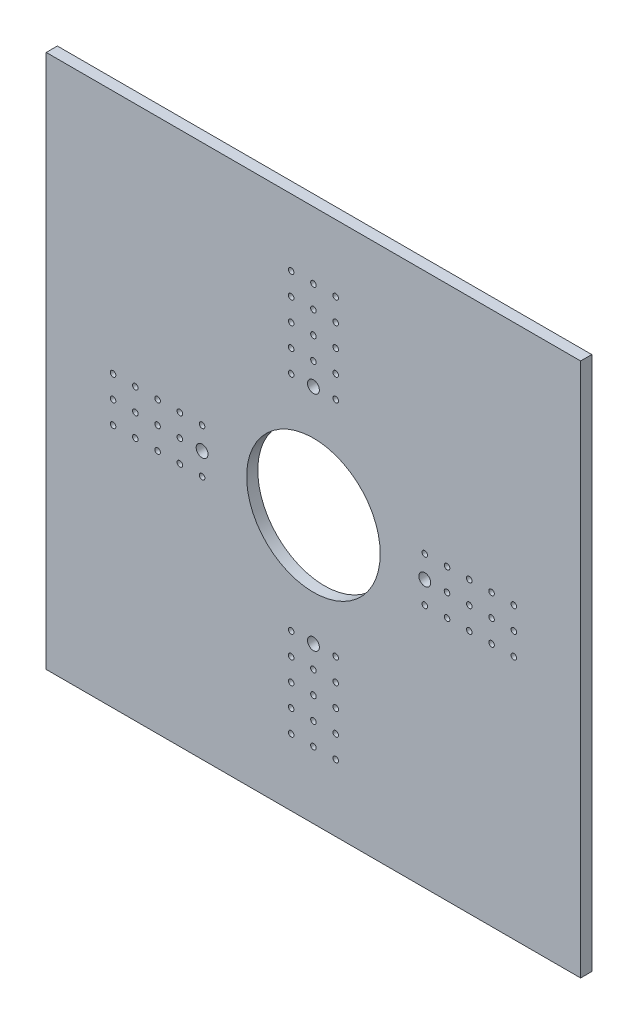
from build123d import *

# Parameters (mm, degrees)
SKETCH1_W                    = 609.6
SKETCH1_H                    = 609.6
SKETCH1_R                    = 76.2
BOSS_EXTRUDE1_DEPTH          = 12.7
CUT_EXTRUDE1_REACH           = 433.239
SKETCH3_R                    = 3.175
LPATTERN1_COUNT              = 5
LPATTERN1_PITCH              = 25.4
CIRPATTERN1_COUNT            = 4
CIRPATTERN1_COPY_1_REACH     = 433.239
CIRPATTERN1_COPY_1_SKETCH_R  = 3.175
CIRPATTERN1_COPY_2_REACH     = 433.239
CIRPATTERN1_COPY_2_SKETCH_R  = 3.175
CIRPATTERN1_COPY_3_REACH     = 433.239
CIRPATTERN1_COPY_3_SKETCH_R  = 3.175
CIRPATTERN1_COPY_4_REACH     = 433.239
CIRPATTERN1_COPY_4_SKETCH_R  = 3.175
CIRPATTERN1_COPY_5_REACH     = 433.239
CIRPATTERN1_COPY_5_SKETCH_R  = 3.175
CIRPATTERN1_COPY_6_REACH     = 433.239
CIRPATTERN1_COPY_6_SKETCH_R  = 3.175
CIRPATTERN1_COPY_7_REACH     = 433.239
CIRPATTERN1_COPY_7_SKETCH_R  = 3.175
CIRPATTERN1_COPY_8_REACH     = 433.239
CIRPATTERN1_COPY_8_SKETCH_R  = 3.175
CIRPATTERN1_COPY_9_REACH     = 433.239
CIRPATTERN1_COPY_9_SKETCH_R  = 3.175
CIRPATTERN1_COPY_10_REACH    = 433.239
CIRPATTERN1_COPY_10_SKETCH_R = 3.175
CIRPATTERN1_COPY_11_REACH    = 433.239
CIRPATTERN1_COPY_11_SKETCH_R = 3.175
CIRPATTERN1_COPY_12_REACH    = 433.239
CIRPATTERN1_COPY_12_SKETCH_R = 3.175
CUT_EXTRUDE2_REACH           = 433.239
SKETCH4_R                    = 6.75767
CIRPATTERN2_COUNT            = 4


with BuildPart() as part:
    # Sketch1 → Boss-Extrude1 (new body)
    with BuildSketch(Plane.XY):
        Rectangle(SKETCH1_W, SKETCH1_H)
        Circle(SKETCH1_R, mode=Mode.SUBTRACT)
    extrude(amount=-BOSS_EXTRUDE1_DEPTH)

    # Sketch3 → Cut-Extrude1 (cut, up to next)
    with BuildSketch(Plane.XY, mode=Mode.PRIVATE) as cut_extrude1_sk1:
        with Locations((-127, 0)):
            Circle(SKETCH3_R)
    cut_extrude1_tool1 = extrude(cut_extrude1_sk1.sketch, amount=-CUT_EXTRUDE1_REACH, mode=Mode.PRIVATE) & part.part
    # Sketch3 → Cut-Extrude1 (cut, up to next)
    with BuildSketch(Plane.XY, mode=Mode.PRIVATE) as cut_extrude1_sk2:
        with Locations((-127, 25.4)):
            Circle(SKETCH3_R)
    cut_extrude1_tool2 = extrude(cut_extrude1_sk2.sketch, amount=-CUT_EXTRUDE1_REACH, mode=Mode.PRIVATE) & part.part
    # Sketch3 → Cut-Extrude1 (cut, up to next)
    with BuildSketch(Plane.XY, mode=Mode.PRIVATE) as cut_extrude1_sk3:
        with Locations((-127, -25.4)):
            Circle(SKETCH3_R)
    cut_extrude1_tool3 = extrude(cut_extrude1_sk3.sketch, amount=-CUT_EXTRUDE1_REACH, mode=Mode.PRIVATE) & part.part
    cut_extrude1_1 = cut_extrude1_tool1.solids().sort_by_distance((-127, 0, 0))[0]
    add(cut_extrude1_1, mode=Mode.SUBTRACT)
    cut_extrude1_2 = cut_extrude1_tool2.solids().sort_by_distance((-127, 25.4, 0))[0]
    add(cut_extrude1_2, mode=Mode.SUBTRACT)
    cut_extrude1_3 = cut_extrude1_tool3.solids().sort_by_distance((-127, -25.4, 0))[0]
    add(cut_extrude1_3, mode=Mode.SUBTRACT)
    cut_extrude1 = cut_extrude1_1 + cut_extrude1_2 + cut_extrude1_3  # Cut-Extrude1 as one shape, for the pattern or mirror that repeats it

    # LPattern1: Cut-Extrude1 ×5
    with Locations(*[(-i * LPATTERN1_PITCH, 0, 0) for i in range(1, LPATTERN1_COUNT)]):
        add(cut_extrude1, mode=Mode.SUBTRACT)

    # CirPattern1: Cut-Extrude1 ×4 about axis
    cirpattern1_axis = Axis((0, 0, -12.7), (0, 0, 1))
    for i in range(1, CIRPATTERN1_COUNT):
        add(cut_extrude1.rotate(cirpattern1_axis, i * 360 / CIRPATTERN1_COUNT), mode=Mode.SUBTRACT)

    # CirPattern1 copy 1 sketch → CirPattern1 copy 1 (cut, up to next)
    with BuildSketch(Plane(origin=(0, -25.4, 0), x_dir=(0, 1, 0), z_dir=(0, 0, 1)), mode=Mode.PRIVATE) as cirpattern1_copy_1_sk1:
        with Locations((-127, 0)):
            Circle(CIRPATTERN1_COPY_1_SKETCH_R)
    cirpattern1_copy_1_tool1 = extrude(cirpattern1_copy_1_sk1.sketch, amount=-CIRPATTERN1_COPY_1_REACH, mode=Mode.PRIVATE) & part.part
    # CirPattern1 copy 1 sketch → CirPattern1 copy 1 (cut, up to next)
    with BuildSketch(Plane(origin=(0, -25.4, 0), x_dir=(0, 1, 0), z_dir=(0, 0, 1)), mode=Mode.PRIVATE) as cirpattern1_copy_1_sk2:
        with Locations((-127, 25.4)):
            Circle(CIRPATTERN1_COPY_1_SKETCH_R)
    cirpattern1_copy_1_tool2 = extrude(cirpattern1_copy_1_sk2.sketch, amount=-CIRPATTERN1_COPY_1_REACH, mode=Mode.PRIVATE) & part.part
    # CirPattern1 copy 1 sketch → CirPattern1 copy 1 (cut, up to next)
    with BuildSketch(Plane(origin=(0, -25.4, 0), x_dir=(0, 1, 0), z_dir=(0, 0, 1)), mode=Mode.PRIVATE) as cirpattern1_copy_1_sk3:
        with Locations((-127, -25.4)):
            Circle(CIRPATTERN1_COPY_1_SKETCH_R)
    cirpattern1_copy_1_tool3 = extrude(cirpattern1_copy_1_sk3.sketch, amount=-CIRPATTERN1_COPY_1_REACH, mode=Mode.PRIVATE) & part.part
    add(cirpattern1_copy_1_tool1.solids().sort_by_distance((0, -152.4, 0))[0], mode=Mode.SUBTRACT)
    add(cirpattern1_copy_1_tool2.solids().sort_by_distance((-25.4, -152.4, 0))[0], mode=Mode.SUBTRACT)
    add(cirpattern1_copy_1_tool3.solids().sort_by_distance((25.4, -152.4, 0))[0], mode=Mode.SUBTRACT)

    # CirPattern1 copy 2 sketch → CirPattern1 copy 2 (cut, up to next)
    with BuildSketch(Plane(origin=(25.4, 0, 0), x_dir=(-1, 0, 0), z_dir=(0, 0, 1)), mode=Mode.PRIVATE) as cirpattern1_copy_2_sk1:
        with Locations((-127, 0)):
            Circle(CIRPATTERN1_COPY_2_SKETCH_R)
    cirpattern1_copy_2_tool1 = extrude(cirpattern1_copy_2_sk1.sketch, amount=-CIRPATTERN1_COPY_2_REACH, mode=Mode.PRIVATE) & part.part
    # CirPattern1 copy 2 sketch → CirPattern1 copy 2 (cut, up to next)
    with BuildSketch(Plane(origin=(25.4, 0, 0), x_dir=(-1, 0, 0), z_dir=(0, 0, 1)), mode=Mode.PRIVATE) as cirpattern1_copy_2_sk2:
        with Locations((-127, 25.4)):
            Circle(CIRPATTERN1_COPY_2_SKETCH_R)
    cirpattern1_copy_2_tool2 = extrude(cirpattern1_copy_2_sk2.sketch, amount=-CIRPATTERN1_COPY_2_REACH, mode=Mode.PRIVATE) & part.part
    # CirPattern1 copy 2 sketch → CirPattern1 copy 2 (cut, up to next)
    with BuildSketch(Plane(origin=(25.4, 0, 0), x_dir=(-1, 0, 0), z_dir=(0, 0, 1)), mode=Mode.PRIVATE) as cirpattern1_copy_2_sk3:
        with Locations((-127, -25.4)):
            Circle(CIRPATTERN1_COPY_2_SKETCH_R)
    cirpattern1_copy_2_tool3 = extrude(cirpattern1_copy_2_sk3.sketch, amount=-CIRPATTERN1_COPY_2_REACH, mode=Mode.PRIVATE) & part.part
    add(cirpattern1_copy_2_tool1.solids().sort_by_distance((152.4, 0, 0))[0], mode=Mode.SUBTRACT)
    add(cirpattern1_copy_2_tool2.solids().sort_by_distance((152.4, -25.4, 0))[0], mode=Mode.SUBTRACT)
    add(cirpattern1_copy_2_tool3.solids().sort_by_distance((152.4, 25.4, 0))[0], mode=Mode.SUBTRACT)

    # CirPattern1 copy 3 sketch → CirPattern1 copy 3 (cut, up to next)
    with BuildSketch(Plane(origin=(0, 25.4, 0), x_dir=(0, -1, 0), z_dir=(0, 0, 1)), mode=Mode.PRIVATE) as cirpattern1_copy_3_sk1:
        with Locations((-127, 0)):
            Circle(CIRPATTERN1_COPY_3_SKETCH_R)
    cirpattern1_copy_3_tool1 = extrude(cirpattern1_copy_3_sk1.sketch, amount=-CIRPATTERN1_COPY_3_REACH, mode=Mode.PRIVATE) & part.part
    # CirPattern1 copy 3 sketch → CirPattern1 copy 3 (cut, up to next)
    with BuildSketch(Plane(origin=(0, 25.4, 0), x_dir=(0, -1, 0), z_dir=(0, 0, 1)), mode=Mode.PRIVATE) as cirpattern1_copy_3_sk2:
        with Locations((-127, 25.4)):
            Circle(CIRPATTERN1_COPY_3_SKETCH_R)
    cirpattern1_copy_3_tool2 = extrude(cirpattern1_copy_3_sk2.sketch, amount=-CIRPATTERN1_COPY_3_REACH, mode=Mode.PRIVATE) & part.part
    # CirPattern1 copy 3 sketch → CirPattern1 copy 3 (cut, up to next)
    with BuildSketch(Plane(origin=(0, 25.4, 0), x_dir=(0, -1, 0), z_dir=(0, 0, 1)), mode=Mode.PRIVATE) as cirpattern1_copy_3_sk3:
        with Locations((-127, -25.4)):
            Circle(CIRPATTERN1_COPY_3_SKETCH_R)
    cirpattern1_copy_3_tool3 = extrude(cirpattern1_copy_3_sk3.sketch, amount=-CIRPATTERN1_COPY_3_REACH, mode=Mode.PRIVATE) & part.part
    add(cirpattern1_copy_3_tool1.solids().sort_by_distance((0, 152.4, 0))[0], mode=Mode.SUBTRACT)
    add(cirpattern1_copy_3_tool2.solids().sort_by_distance((25.4, 152.4, 0))[0], mode=Mode.SUBTRACT)
    add(cirpattern1_copy_3_tool3.solids().sort_by_distance((-25.4, 152.4, 0))[0], mode=Mode.SUBTRACT)

    # CirPattern1 copy 4 sketch → CirPattern1 copy 4 (cut, up to next)
    with BuildSketch(Plane(origin=(0, -50.8, 0), x_dir=(0, 1, 0), z_dir=(0, 0, 1)), mode=Mode.PRIVATE) as cirpattern1_copy_4_sk1:
        with Locations((-127, 0)):
            Circle(CIRPATTERN1_COPY_4_SKETCH_R)
    cirpattern1_copy_4_tool1 = extrude(cirpattern1_copy_4_sk1.sketch, amount=-CIRPATTERN1_COPY_4_REACH, mode=Mode.PRIVATE) & part.part
    # CirPattern1 copy 4 sketch → CirPattern1 copy 4 (cut, up to next)
    with BuildSketch(Plane(origin=(0, -50.8, 0), x_dir=(0, 1, 0), z_dir=(0, 0, 1)), mode=Mode.PRIVATE) as cirpattern1_copy_4_sk2:
        with Locations((-127, 25.4)):
            Circle(CIRPATTERN1_COPY_4_SKETCH_R)
    cirpattern1_copy_4_tool2 = extrude(cirpattern1_copy_4_sk2.sketch, amount=-CIRPATTERN1_COPY_4_REACH, mode=Mode.PRIVATE) & part.part
    # CirPattern1 copy 4 sketch → CirPattern1 copy 4 (cut, up to next)
    with BuildSketch(Plane(origin=(0, -50.8, 0), x_dir=(0, 1, 0), z_dir=(0, 0, 1)), mode=Mode.PRIVATE) as cirpattern1_copy_4_sk3:
        with Locations((-127, -25.4)):
            Circle(CIRPATTERN1_COPY_4_SKETCH_R)
    cirpattern1_copy_4_tool3 = extrude(cirpattern1_copy_4_sk3.sketch, amount=-CIRPATTERN1_COPY_4_REACH, mode=Mode.PRIVATE) & part.part
    add(cirpattern1_copy_4_tool1.solids().sort_by_distance((0, -177.8, 0))[0], mode=Mode.SUBTRACT)
    add(cirpattern1_copy_4_tool2.solids().sort_by_distance((-25.4, -177.8, 0))[0], mode=Mode.SUBTRACT)
    add(cirpattern1_copy_4_tool3.solids().sort_by_distance((25.4, -177.8, 0))[0], mode=Mode.SUBTRACT)

    # CirPattern1 copy 5 sketch → CirPattern1 copy 5 (cut, up to next)
    with BuildSketch(Plane(origin=(50.8, 0, 0), x_dir=(-1, 0, 0), z_dir=(0, 0, 1)), mode=Mode.PRIVATE) as cirpattern1_copy_5_sk1:
        with Locations((-127, 0)):
            Circle(CIRPATTERN1_COPY_5_SKETCH_R)
    cirpattern1_copy_5_tool1 = extrude(cirpattern1_copy_5_sk1.sketch, amount=-CIRPATTERN1_COPY_5_REACH, mode=Mode.PRIVATE) & part.part
    # CirPattern1 copy 5 sketch → CirPattern1 copy 5 (cut, up to next)
    with BuildSketch(Plane(origin=(50.8, 0, 0), x_dir=(-1, 0, 0), z_dir=(0, 0, 1)), mode=Mode.PRIVATE) as cirpattern1_copy_5_sk2:
        with Locations((-127, 25.4)):
            Circle(CIRPATTERN1_COPY_5_SKETCH_R)
    cirpattern1_copy_5_tool2 = extrude(cirpattern1_copy_5_sk2.sketch, amount=-CIRPATTERN1_COPY_5_REACH, mode=Mode.PRIVATE) & part.part
    # CirPattern1 copy 5 sketch → CirPattern1 copy 5 (cut, up to next)
    with BuildSketch(Plane(origin=(50.8, 0, 0), x_dir=(-1, 0, 0), z_dir=(0, 0, 1)), mode=Mode.PRIVATE) as cirpattern1_copy_5_sk3:
        with Locations((-127, -25.4)):
            Circle(CIRPATTERN1_COPY_5_SKETCH_R)
    cirpattern1_copy_5_tool3 = extrude(cirpattern1_copy_5_sk3.sketch, amount=-CIRPATTERN1_COPY_5_REACH, mode=Mode.PRIVATE) & part.part
    add(cirpattern1_copy_5_tool1.solids().sort_by_distance((177.8, 0, 0))[0], mode=Mode.SUBTRACT)
    add(cirpattern1_copy_5_tool2.solids().sort_by_distance((177.8, -25.4, 0))[0], mode=Mode.SUBTRACT)
    add(cirpattern1_copy_5_tool3.solids().sort_by_distance((177.8, 25.4, 0))[0], mode=Mode.SUBTRACT)

    # CirPattern1 copy 6 sketch → CirPattern1 copy 6 (cut, up to next)
    with BuildSketch(Plane(origin=(0, 50.8, 0), x_dir=(0, -1, 0), z_dir=(0, 0, 1)), mode=Mode.PRIVATE) as cirpattern1_copy_6_sk1:
        with Locations((-127, 0)):
            Circle(CIRPATTERN1_COPY_6_SKETCH_R)
    cirpattern1_copy_6_tool1 = extrude(cirpattern1_copy_6_sk1.sketch, amount=-CIRPATTERN1_COPY_6_REACH, mode=Mode.PRIVATE) & part.part
    # CirPattern1 copy 6 sketch → CirPattern1 copy 6 (cut, up to next)
    with BuildSketch(Plane(origin=(0, 50.8, 0), x_dir=(0, -1, 0), z_dir=(0, 0, 1)), mode=Mode.PRIVATE) as cirpattern1_copy_6_sk2:
        with Locations((-127, 25.4)):
            Circle(CIRPATTERN1_COPY_6_SKETCH_R)
    cirpattern1_copy_6_tool2 = extrude(cirpattern1_copy_6_sk2.sketch, amount=-CIRPATTERN1_COPY_6_REACH, mode=Mode.PRIVATE) & part.part
    # CirPattern1 copy 6 sketch → CirPattern1 copy 6 (cut, up to next)
    with BuildSketch(Plane(origin=(0, 50.8, 0), x_dir=(0, -1, 0), z_dir=(0, 0, 1)), mode=Mode.PRIVATE) as cirpattern1_copy_6_sk3:
        with Locations((-127, -25.4)):
            Circle(CIRPATTERN1_COPY_6_SKETCH_R)
    cirpattern1_copy_6_tool3 = extrude(cirpattern1_copy_6_sk3.sketch, amount=-CIRPATTERN1_COPY_6_REACH, mode=Mode.PRIVATE) & part.part
    add(cirpattern1_copy_6_tool1.solids().sort_by_distance((0, 177.8, 0))[0], mode=Mode.SUBTRACT)
    add(cirpattern1_copy_6_tool2.solids().sort_by_distance((25.4, 177.8, 0))[0], mode=Mode.SUBTRACT)
    add(cirpattern1_copy_6_tool3.solids().sort_by_distance((-25.4, 177.8, 0))[0], mode=Mode.SUBTRACT)

    # CirPattern1 copy 7 sketch → CirPattern1 copy 7 (cut, up to next)
    with BuildSketch(Plane(origin=(0, -76.2, 0), x_dir=(0, 1, 0), z_dir=(0, 0, 1)), mode=Mode.PRIVATE) as cirpattern1_copy_7_sk1:
        with Locations((-127, 0)):
            Circle(CIRPATTERN1_COPY_7_SKETCH_R)
    cirpattern1_copy_7_tool1 = extrude(cirpattern1_copy_7_sk1.sketch, amount=-CIRPATTERN1_COPY_7_REACH, mode=Mode.PRIVATE) & part.part
    # CirPattern1 copy 7 sketch → CirPattern1 copy 7 (cut, up to next)
    with BuildSketch(Plane(origin=(0, -76.2, 0), x_dir=(0, 1, 0), z_dir=(0, 0, 1)), mode=Mode.PRIVATE) as cirpattern1_copy_7_sk2:
        with Locations((-127, 25.4)):
            Circle(CIRPATTERN1_COPY_7_SKETCH_R)
    cirpattern1_copy_7_tool2 = extrude(cirpattern1_copy_7_sk2.sketch, amount=-CIRPATTERN1_COPY_7_REACH, mode=Mode.PRIVATE) & part.part
    # CirPattern1 copy 7 sketch → CirPattern1 copy 7 (cut, up to next)
    with BuildSketch(Plane(origin=(0, -76.2, 0), x_dir=(0, 1, 0), z_dir=(0, 0, 1)), mode=Mode.PRIVATE) as cirpattern1_copy_7_sk3:
        with Locations((-127, -25.4)):
            Circle(CIRPATTERN1_COPY_7_SKETCH_R)
    cirpattern1_copy_7_tool3 = extrude(cirpattern1_copy_7_sk3.sketch, amount=-CIRPATTERN1_COPY_7_REACH, mode=Mode.PRIVATE) & part.part
    add(cirpattern1_copy_7_tool1.solids().sort_by_distance((0, -203.2, 0))[0], mode=Mode.SUBTRACT)
    add(cirpattern1_copy_7_tool2.solids().sort_by_distance((-25.4, -203.2, 0))[0], mode=Mode.SUBTRACT)
    add(cirpattern1_copy_7_tool3.solids().sort_by_distance((25.4, -203.2, 0))[0], mode=Mode.SUBTRACT)

    # CirPattern1 copy 8 sketch → CirPattern1 copy 8 (cut, up to next)
    with BuildSketch(Plane(origin=(76.2, 0, 0), x_dir=(-1, 0, 0), z_dir=(0, 0, 1)), mode=Mode.PRIVATE) as cirpattern1_copy_8_sk1:
        with Locations((-127, 0)):
            Circle(CIRPATTERN1_COPY_8_SKETCH_R)
    cirpattern1_copy_8_tool1 = extrude(cirpattern1_copy_8_sk1.sketch, amount=-CIRPATTERN1_COPY_8_REACH, mode=Mode.PRIVATE) & part.part
    # CirPattern1 copy 8 sketch → CirPattern1 copy 8 (cut, up to next)
    with BuildSketch(Plane(origin=(76.2, 0, 0), x_dir=(-1, 0, 0), z_dir=(0, 0, 1)), mode=Mode.PRIVATE) as cirpattern1_copy_8_sk2:
        with Locations((-127, 25.4)):
            Circle(CIRPATTERN1_COPY_8_SKETCH_R)
    cirpattern1_copy_8_tool2 = extrude(cirpattern1_copy_8_sk2.sketch, amount=-CIRPATTERN1_COPY_8_REACH, mode=Mode.PRIVATE) & part.part
    # CirPattern1 copy 8 sketch → CirPattern1 copy 8 (cut, up to next)
    with BuildSketch(Plane(origin=(76.2, 0, 0), x_dir=(-1, 0, 0), z_dir=(0, 0, 1)), mode=Mode.PRIVATE) as cirpattern1_copy_8_sk3:
        with Locations((-127, -25.4)):
            Circle(CIRPATTERN1_COPY_8_SKETCH_R)
    cirpattern1_copy_8_tool3 = extrude(cirpattern1_copy_8_sk3.sketch, amount=-CIRPATTERN1_COPY_8_REACH, mode=Mode.PRIVATE) & part.part
    add(cirpattern1_copy_8_tool1.solids().sort_by_distance((203.2, 0, 0))[0], mode=Mode.SUBTRACT)
    add(cirpattern1_copy_8_tool2.solids().sort_by_distance((203.2, -25.4, 0))[0], mode=Mode.SUBTRACT)
    add(cirpattern1_copy_8_tool3.solids().sort_by_distance((203.2, 25.4, 0))[0], mode=Mode.SUBTRACT)

    # CirPattern1 copy 9 sketch → CirPattern1 copy 9 (cut, up to next)
    with BuildSketch(Plane(origin=(0, 76.2, 0), x_dir=(0, -1, 0), z_dir=(0, 0, 1)), mode=Mode.PRIVATE) as cirpattern1_copy_9_sk1:
        with Locations((-127, 0)):
            Circle(CIRPATTERN1_COPY_9_SKETCH_R)
    cirpattern1_copy_9_tool1 = extrude(cirpattern1_copy_9_sk1.sketch, amount=-CIRPATTERN1_COPY_9_REACH, mode=Mode.PRIVATE) & part.part
    # CirPattern1 copy 9 sketch → CirPattern1 copy 9 (cut, up to next)
    with BuildSketch(Plane(origin=(0, 76.2, 0), x_dir=(0, -1, 0), z_dir=(0, 0, 1)), mode=Mode.PRIVATE) as cirpattern1_copy_9_sk2:
        with Locations((-127, 25.4)):
            Circle(CIRPATTERN1_COPY_9_SKETCH_R)
    cirpattern1_copy_9_tool2 = extrude(cirpattern1_copy_9_sk2.sketch, amount=-CIRPATTERN1_COPY_9_REACH, mode=Mode.PRIVATE) & part.part
    # CirPattern1 copy 9 sketch → CirPattern1 copy 9 (cut, up to next)
    with BuildSketch(Plane(origin=(0, 76.2, 0), x_dir=(0, -1, 0), z_dir=(0, 0, 1)), mode=Mode.PRIVATE) as cirpattern1_copy_9_sk3:
        with Locations((-127, -25.4)):
            Circle(CIRPATTERN1_COPY_9_SKETCH_R)
    cirpattern1_copy_9_tool3 = extrude(cirpattern1_copy_9_sk3.sketch, amount=-CIRPATTERN1_COPY_9_REACH, mode=Mode.PRIVATE) & part.part
    add(cirpattern1_copy_9_tool1.solids().sort_by_distance((0, 203.2, 0))[0], mode=Mode.SUBTRACT)
    add(cirpattern1_copy_9_tool2.solids().sort_by_distance((25.4, 203.2, 0))[0], mode=Mode.SUBTRACT)
    add(cirpattern1_copy_9_tool3.solids().sort_by_distance((-25.4, 203.2, 0))[0], mode=Mode.SUBTRACT)

    # CirPattern1 copy 10 sketch → CirPattern1 copy 10 (cut, up to next)
    with BuildSketch(Plane(origin=(0, -101.6, 0), x_dir=(0, 1, 0), z_dir=(0, 0, 1)), mode=Mode.PRIVATE) as cirpattern1_copy_10_sk1:
        with Locations((-127, 0)):
            Circle(CIRPATTERN1_COPY_10_SKETCH_R)
    cirpattern1_copy_10_tool1 = extrude(cirpattern1_copy_10_sk1.sketch, amount=-CIRPATTERN1_COPY_10_REACH, mode=Mode.PRIVATE) & part.part
    # CirPattern1 copy 10 sketch → CirPattern1 copy 10 (cut, up to next)
    with BuildSketch(Plane(origin=(0, -101.6, 0), x_dir=(0, 1, 0), z_dir=(0, 0, 1)), mode=Mode.PRIVATE) as cirpattern1_copy_10_sk2:
        with Locations((-127, 25.4)):
            Circle(CIRPATTERN1_COPY_10_SKETCH_R)
    cirpattern1_copy_10_tool2 = extrude(cirpattern1_copy_10_sk2.sketch, amount=-CIRPATTERN1_COPY_10_REACH, mode=Mode.PRIVATE) & part.part
    # CirPattern1 copy 10 sketch → CirPattern1 copy 10 (cut, up to next)
    with BuildSketch(Plane(origin=(0, -101.6, 0), x_dir=(0, 1, 0), z_dir=(0, 0, 1)), mode=Mode.PRIVATE) as cirpattern1_copy_10_sk3:
        with Locations((-127, -25.4)):
            Circle(CIRPATTERN1_COPY_10_SKETCH_R)
    cirpattern1_copy_10_tool3 = extrude(cirpattern1_copy_10_sk3.sketch, amount=-CIRPATTERN1_COPY_10_REACH, mode=Mode.PRIVATE) & part.part
    add(cirpattern1_copy_10_tool1.solids().sort_by_distance((0, -228.6, 0))[0], mode=Mode.SUBTRACT)
    add(cirpattern1_copy_10_tool2.solids().sort_by_distance((-25.4, -228.6, 0))[0], mode=Mode.SUBTRACT)
    add(cirpattern1_copy_10_tool3.solids().sort_by_distance((25.4, -228.6, 0))[0], mode=Mode.SUBTRACT)

    # CirPattern1 copy 11 sketch → CirPattern1 copy 11 (cut, up to next)
    with BuildSketch(Plane(origin=(101.6, 0, 0), x_dir=(-1, 0, 0), z_dir=(0, 0, 1)), mode=Mode.PRIVATE) as cirpattern1_copy_11_sk1:
        with Locations((-127, 0)):
            Circle(CIRPATTERN1_COPY_11_SKETCH_R)
    cirpattern1_copy_11_tool1 = extrude(cirpattern1_copy_11_sk1.sketch, amount=-CIRPATTERN1_COPY_11_REACH, mode=Mode.PRIVATE) & part.part
    # CirPattern1 copy 11 sketch → CirPattern1 copy 11 (cut, up to next)
    with BuildSketch(Plane(origin=(101.6, 0, 0), x_dir=(-1, 0, 0), z_dir=(0, 0, 1)), mode=Mode.PRIVATE) as cirpattern1_copy_11_sk2:
        with Locations((-127, 25.4)):
            Circle(CIRPATTERN1_COPY_11_SKETCH_R)
    cirpattern1_copy_11_tool2 = extrude(cirpattern1_copy_11_sk2.sketch, amount=-CIRPATTERN1_COPY_11_REACH, mode=Mode.PRIVATE) & part.part
    # CirPattern1 copy 11 sketch → CirPattern1 copy 11 (cut, up to next)
    with BuildSketch(Plane(origin=(101.6, 0, 0), x_dir=(-1, 0, 0), z_dir=(0, 0, 1)), mode=Mode.PRIVATE) as cirpattern1_copy_11_sk3:
        with Locations((-127, -25.4)):
            Circle(CIRPATTERN1_COPY_11_SKETCH_R)
    cirpattern1_copy_11_tool3 = extrude(cirpattern1_copy_11_sk3.sketch, amount=-CIRPATTERN1_COPY_11_REACH, mode=Mode.PRIVATE) & part.part
    add(cirpattern1_copy_11_tool1.solids().sort_by_distance((228.6, 0, 0))[0], mode=Mode.SUBTRACT)
    add(cirpattern1_copy_11_tool2.solids().sort_by_distance((228.6, -25.4, 0))[0], mode=Mode.SUBTRACT)
    add(cirpattern1_copy_11_tool3.solids().sort_by_distance((228.6, 25.4, 0))[0], mode=Mode.SUBTRACT)

    # CirPattern1 copy 12 sketch → CirPattern1 copy 12 (cut, up to next)
    with BuildSketch(Plane(origin=(0, 101.6, 0), x_dir=(0, -1, 0), z_dir=(0, 0, 1)), mode=Mode.PRIVATE) as cirpattern1_copy_12_sk1:
        with Locations((-127, 0)):
            Circle(CIRPATTERN1_COPY_12_SKETCH_R)
    cirpattern1_copy_12_tool1 = extrude(cirpattern1_copy_12_sk1.sketch, amount=-CIRPATTERN1_COPY_12_REACH, mode=Mode.PRIVATE) & part.part
    # CirPattern1 copy 12 sketch → CirPattern1 copy 12 (cut, up to next)
    with BuildSketch(Plane(origin=(0, 101.6, 0), x_dir=(0, -1, 0), z_dir=(0, 0, 1)), mode=Mode.PRIVATE) as cirpattern1_copy_12_sk2:
        with Locations((-127, 25.4)):
            Circle(CIRPATTERN1_COPY_12_SKETCH_R)
    cirpattern1_copy_12_tool2 = extrude(cirpattern1_copy_12_sk2.sketch, amount=-CIRPATTERN1_COPY_12_REACH, mode=Mode.PRIVATE) & part.part
    # CirPattern1 copy 12 sketch → CirPattern1 copy 12 (cut, up to next)
    with BuildSketch(Plane(origin=(0, 101.6, 0), x_dir=(0, -1, 0), z_dir=(0, 0, 1)), mode=Mode.PRIVATE) as cirpattern1_copy_12_sk3:
        with Locations((-127, -25.4)):
            Circle(CIRPATTERN1_COPY_12_SKETCH_R)
    cirpattern1_copy_12_tool3 = extrude(cirpattern1_copy_12_sk3.sketch, amount=-CIRPATTERN1_COPY_12_REACH, mode=Mode.PRIVATE) & part.part
    add(cirpattern1_copy_12_tool1.solids().sort_by_distance((0, 228.6, 0))[0], mode=Mode.SUBTRACT)
    add(cirpattern1_copy_12_tool2.solids().sort_by_distance((25.4, 228.6, 0))[0], mode=Mode.SUBTRACT)
    add(cirpattern1_copy_12_tool3.solids().sort_by_distance((-25.4, 228.6, 0))[0], mode=Mode.SUBTRACT)

    # Sketch4 → Cut-Extrude2 (cut, up to next)
    with BuildSketch(Plane.XY, mode=Mode.PRIVATE) as cut_extrude2_sk1:
        with Locations((-127, 0)):
            Circle(SKETCH4_R)
    cut_extrude2_tool1 = extrude(cut_extrude2_sk1.sketch, amount=-CUT_EXTRUDE2_REACH, mode=Mode.PRIVATE) & part.part
    cut_extrude2 = cut_extrude2_tool1.solids().sort_by_distance((-127, 0, 0))[0]
    add(cut_extrude2, mode=Mode.SUBTRACT)

    # CirPattern2: Cut-Extrude2 ×4 about axis
    cirpattern2_axis = Axis((0, 0, -12.7), (0, 0, 1))
    for i in range(1, CIRPATTERN2_COUNT):
        add(cut_extrude2.rotate(cirpattern2_axis, i * 360 / CIRPATTERN2_COUNT), mode=Mode.SUBTRACT)


solid = part.part
